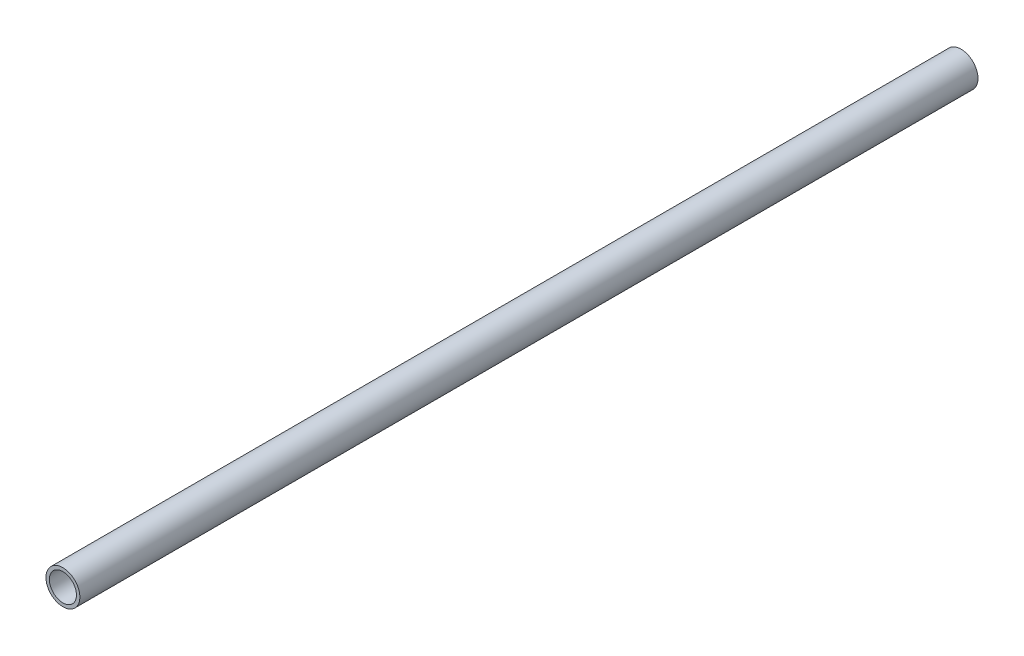
from build123d import *

# Parameters (mm, degrees)
SCHIZZO1_R                   = 10
SCHIZZO1_R_2                 = 8
ESTRUSIONE_ESTRUSIONE1_DEPTH = 530


with BuildPart() as part:
    # Schizzo1 → Estrusione-Estrusione1 (new body)
    with BuildSketch(Plane.XY):
        Circle(SCHIZZO1_R)
        Circle(SCHIZZO1_R_2, mode=Mode.SUBTRACT)
    extrude(amount=ESTRUSIONE_ESTRUSIONE1_DEPTH)


solid = part.part
